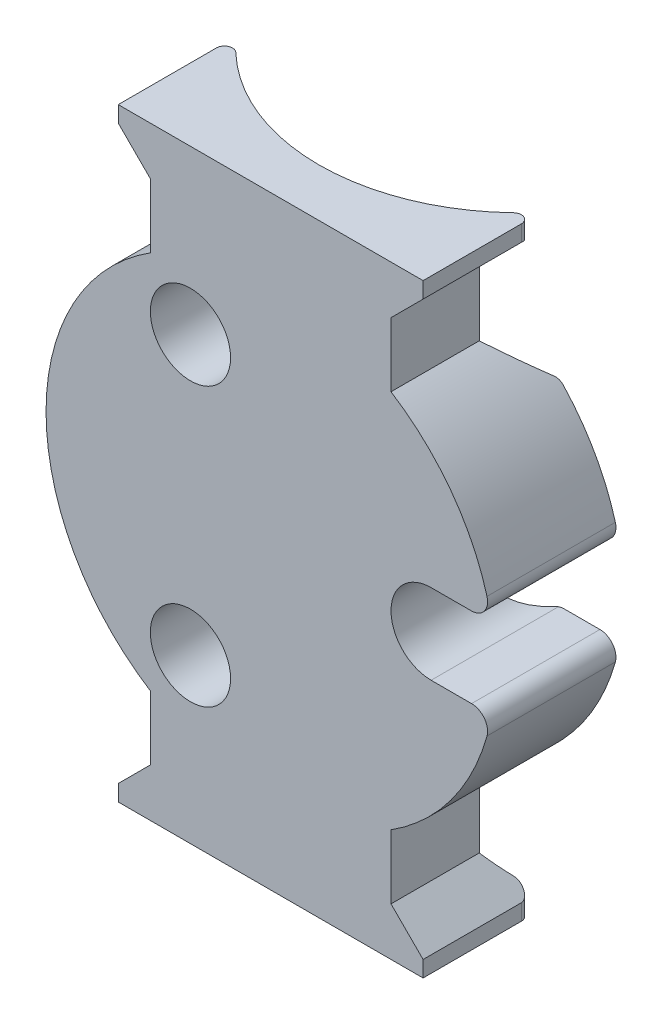
from build123d import *

# Parameters (mm, degrees)
SKETCH1_R               = 1.350662837
BOSS_EXTRUDE1_DEPTH     = 3
BOSS_EXTRUDE2_OUTLINE_R = 1.350662837
BOSS_EXTRUDE2_DEPTH     = 5
BOSS_EXTRUDE2_START     = -18.821590418
BOSS_EXTRUDE2_2_DEPTH   = 37.643180836
FILLET1_R               = 0.5
SKETCH5_R               = 2.5
CUT_EXTRUDE1_DEPTH      = 25.78411334
FILLET2_R               = 0.5
FILLET3_R               = 1


with BuildPart() as part:
    # Sketch1 → Boss-Extrude1 (new body)
    with BuildSketch(Plane.XY):
        with BuildLine():
            Line((7.5, 18.821590418), (9.5, 18.821590418))
            Line((9.5, 18.821590418), (9.5, 17.821590418))
            Line((9.5, 17.821590418), (7.5, 15.821590418))
            Line((7.5, 15.821590418), (7.5, 11.821590418))
            ThreePointArc((7.5, 11.821590418), (14, 0), (7.5, -11.821590418))
            Line((7.5, -11.821590418), (7.5, -15.821590418))
            Line((7.5, -15.821590418), (9.5, -17.821590418))
            Line((9.5, -17.821590418), (9.5, -18.821590418))
            Line((9.5, -18.821590418), (7.5, -18.821590418))
            Line((7.5, -18.821590418), (-7.5, -18.821590418))
            Line((-7.5, -18.821590418), (-9.5, -18.821590418))
            Line((-9.5, -18.821590418), (-9.5, -17.821590418))
            Line((-9.5, -17.821590418), (-7.5, -15.821590418))
            Line((-7.5, -15.821590418), (-7.5, -11.821590418))
            ThreePointArc((-7.5, -11.821590418), (-14, 0), (-7.5, 11.821590418))
            Line((-7.5, 11.821590418), (-7.5, 15.821590418))
            Line((-7.5, 15.821590418), (-9.5, 17.821590418))
            Line((-9.5, 17.821590418), (-9.5, 18.821590418))
            Line((-9.5, 18.821590418), (-7.5, 18.821590418))
            Line((-7.5, 18.821590418), (7.5, 18.821590418))
        make_face()
        with Locations((-5, -8.660254038)):
            Circle(SKETCH1_R, mode=Mode.SUBTRACT)
        with Locations((10, 0)):
            Circle(SKETCH1_R, mode=Mode.SUBTRACT)
        with Locations((-5, 8.660254038)):
            Circle(SKETCH1_R, mode=Mode.SUBTRACT)
    extrude(amount=BOSS_EXTRUDE1_DEPTH)

    # Boss-Extrude2: read off the stored shape, not the designer's step
    # Boss-Extrude2 outline → Boss-Extrude2 (add)
    with BuildSketch(Plane(origin=(0, 0, 0), x_dir=(-1, 0, 0), z_dir=(0, 0, -1))):
        with BuildLine():
            Line((-7.5, 15.821590418), (-7.5, 11.821590418))
            ThreePointArc((-7.5, 11.821590418), (-14, 0), (-7.5, -11.821590418))
            Line((-7.5, -11.821590418), (-7.5, -15.821590418))
            Line((-7.5, -15.821590418), (-9.5, -17.821590418))
            Line((-9.5, -17.821590418), (-9.5, -18.821590418))
            Line((-9.5, -18.821590418), (9.5, -18.821590418))
            Line((9.5, -18.821590418), (9.5, -17.821590418))
            Line((9.5, -17.821590418), (7.5, -15.821590418))
            Line((7.5, -15.821590418), (7.5, -11.821590418))
            ThreePointArc((7.5, -11.821590418), (14, 0), (7.5, 11.821590418))
            Line((7.5, 11.821590418), (7.5, 15.821590418))
            Line((7.5, 15.821590418), (9.5, 17.821590418))
            Line((9.5, 17.821590418), (9.5, 18.821590418))
            Line((9.5, 18.821590418), (-9.5, 18.821590418))
            Line((-9.5, 18.821590418), (-9.5, 17.821590418))
            Line((-9.5, 17.821590418), (-7.5, 15.821590418))
        make_face()
        with Locations((5, -8.660254038)):
            Circle(BOSS_EXTRUDE2_OUTLINE_R, mode=Mode.SUBTRACT)
        with Locations((-10, 0)):
            Circle(BOSS_EXTRUDE2_OUTLINE_R, mode=Mode.SUBTRACT)
        with Locations((5, 8.660254038)):
            Circle(BOSS_EXTRUDE2_OUTLINE_R, mode=Mode.SUBTRACT)
    extrude(amount=BOSS_EXTRUDE2_DEPTH)

    # Boss-Extrude2 2 outline → Boss-Extrude2 2 (cut)
    with BuildSketch(Plane(origin=(0, 0, 0), x_dir=(1, 0, 0), z_dir=(0, 1, 0)).offset(BOSS_EXTRUDE2_START)):
        with BuildLine():
            Line((10, 5), (-10, 5))
            ThreePointArc((-10, 5), (0, 0), (10, 5))
        make_face()
    extrude(amount=BOSS_EXTRUDE2_2_DEPTH, mode=Mode.SUBTRACT)

    # Fillet1
    fillet1_edges = [part.edges().sort_by_distance(p)[0] for p in [
        (9.5, 18.321590418, -4.375961595),
        (9.5, -18.321590418, -4.375961595),
        (-9.5, -18.321590418, -4.375961595),
        (-9.5, 18.321590418, -4.375961595),
    ]]
    fillet(fillet1_edges, radius=FILLET1_R)

    # Sketch5 → Cut-Extrude1 (cut, through all)
    with BuildSketch(Plane.XY.offset(3)):
        with Locations((-5, -8.660254038)):
            Circle(SKETCH5_R)
        with Locations((-5, 8.660254038)):
            Circle(SKETCH5_R)
        with BuildLine():
            Line((10, -2.5), (13.774977314, -2.5))
            ThreePointArc((13.774977314, -2.5), (14, 0), (13.774977314, 2.5))
            Line((13.774977314, 2.5), (10, 2.5))
            ThreePointArc((10, 2.5), (7.5, 0), (10, -2.5))
        make_face()
    extrude(amount=-CUT_EXTRUDE1_DEPTH, mode=Mode.SUBTRACT)

    # Fillet2
    fillet2_edges = [part.edges().sort_by_distance(p)[0] for p in [
        (-10, 0, -5),
        (10, -6.148979486, -5),
        (10, 6.148979486, -5),
    ]]
    fillet(fillet2_edges, radius=FILLET2_R)

    # Fillet3
    fillet3_edges = [part.edges().sort_by_distance(p)[0] for p in [
        (13.774977314, 2.5, -2.5),
        (13.774977314, -2.5, -2.5),
    ]]
    fillet(fillet3_edges, radius=FILLET3_R)


solid = part.part
